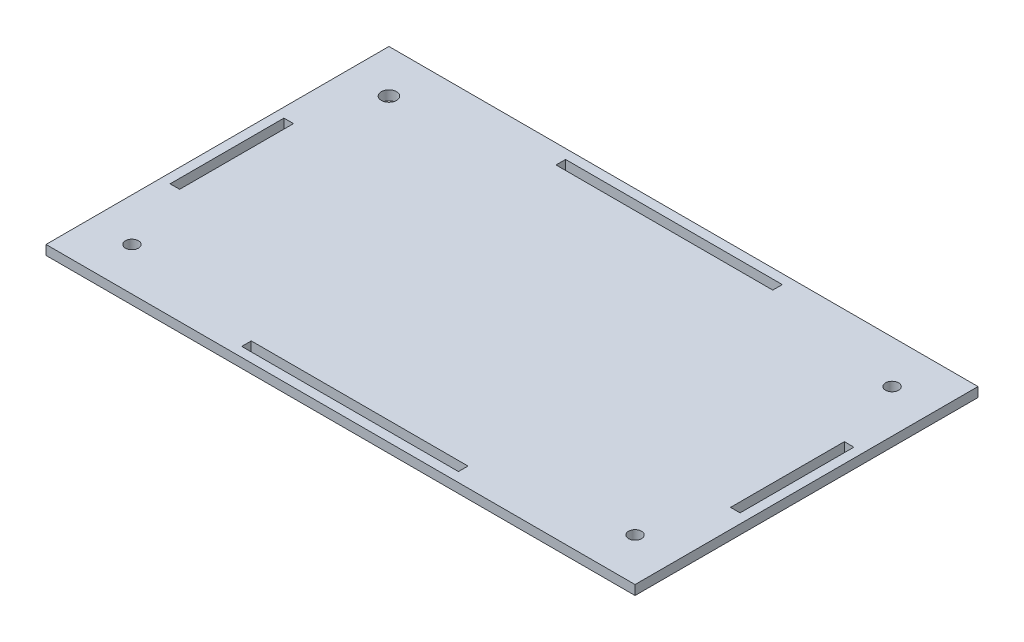
from build123d import *

# Parameters (mm, degrees)
SKETCH2_W           = 123.41
SKETCH2_H           = 71.848
SKETCH2_R           = 1.360904611
SKETCH2_R_2         = 1.6
SKETCH2_W_2         = 2
SKETCH2_H_2         = 23.848
SKETCH2_W_3         = 45.41
SKETCH2_H_3         = 2
BOSS_EXTRUDE1_DEPTH = 2


with BuildPart() as part:
    # Sketch2 → Boss-Extrude1 (new body)
    with BuildSketch(Plane(origin=(0, 0, 0), x_dir=(1, 0, 0), z_dir=(0, 1, 0))):
        with Locations((56.48154317, 30.702122774)):
            Rectangle(SKETCH2_W, SKETCH2_H)
        with Locations((3.77654317, 3.778122774)):
            Circle(SKETCH2_R, mode=Mode.SUBTRACT)
        with Locations((109.18654317, 3.778122774)):
            Circle(SKETCH2_R, mode=Mode.SUBTRACT)
        with Locations((3.77654317, 57.626122774)):
            Circle(SKETCH2_R_2, mode=Mode.SUBTRACT)
        with Locations((109.18654317, 57.626122774)):
            Circle(SKETCH2_R, mode=Mode.SUBTRACT)
        with Locations((-2.22345683, 30.702122774)):
            Rectangle(SKETCH2_W_2, SKETCH2_H_2, mode=Mode.SUBTRACT)
        with Locations((56.48154317, 63.626122774)):
            Rectangle(SKETCH2_W_3, SKETCH2_H_3, mode=Mode.SUBTRACT)
        with Locations((115.18654317, 30.702122774)):
            Rectangle(SKETCH2_W_2, SKETCH2_H_2, mode=Mode.SUBTRACT)
        with Locations((56.48154317, -2.221877226)):
            Rectangle(SKETCH2_W_3, SKETCH2_H_3, mode=Mode.SUBTRACT)
    extrude(amount=BOSS_EXTRUDE1_DEPTH)


solid = part.part
